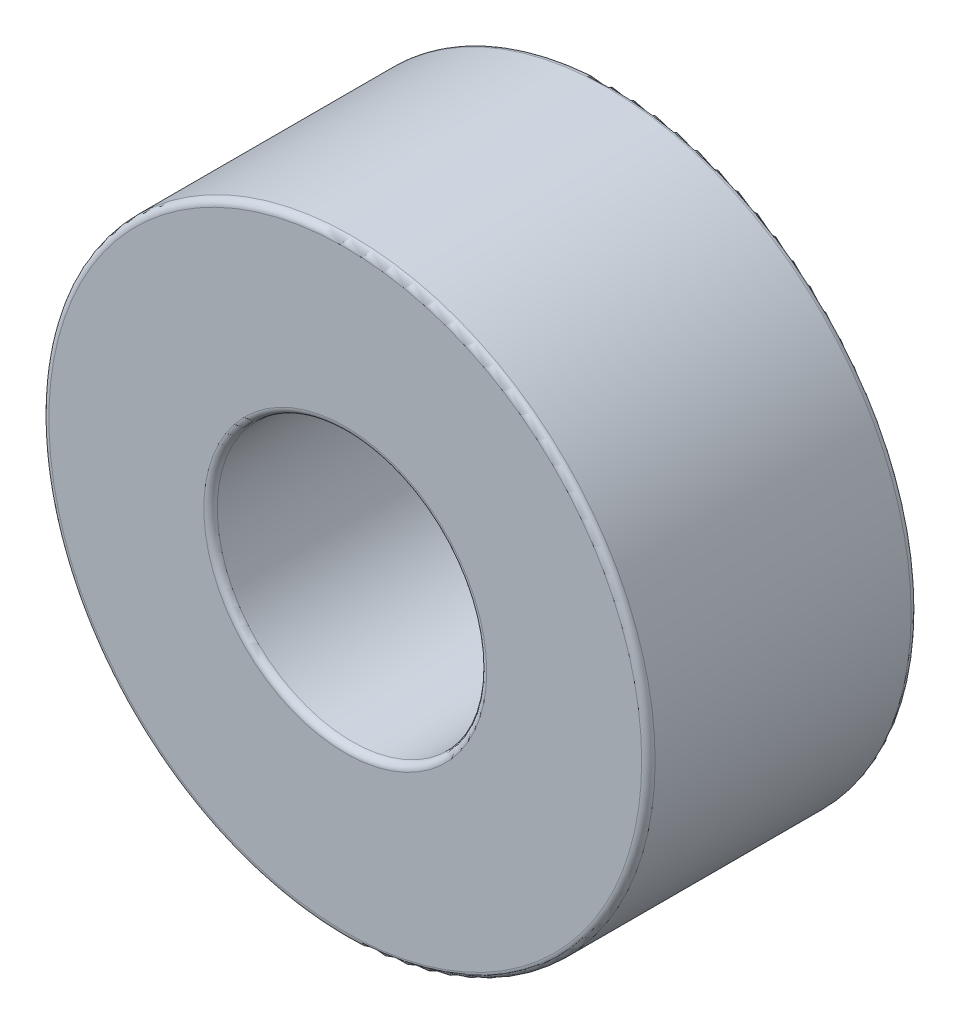
from build123d import *

# Parameters (mm, degrees)
SKETCH1_R           = 4.5
SKETCH1_R_2         = 2
BOSS_EXTRUDE1_DEPTH = 4
FILLET1_R           = 0.1


with BuildPart() as part:
    # Sketch1 → Boss-Extrude1 (new body)
    with BuildSketch(Plane.XY):
        Circle(SKETCH1_R)
        Circle(SKETCH1_R_2, mode=Mode.SUBTRACT)
    extrude(amount=BOSS_EXTRUDE1_DEPTH)

    # Fillet1
    fillet1_edges = [part.edges().sort_by_distance(p)[0] for p in [
        (-2, 0, 0),
        (-4.5, 0, 0),
        (-2, 0, 4),
        (-4.5, 0, 4),
    ]]
    fillet(fillet1_edges, radius=FILLET1_R)


solid = part.part
